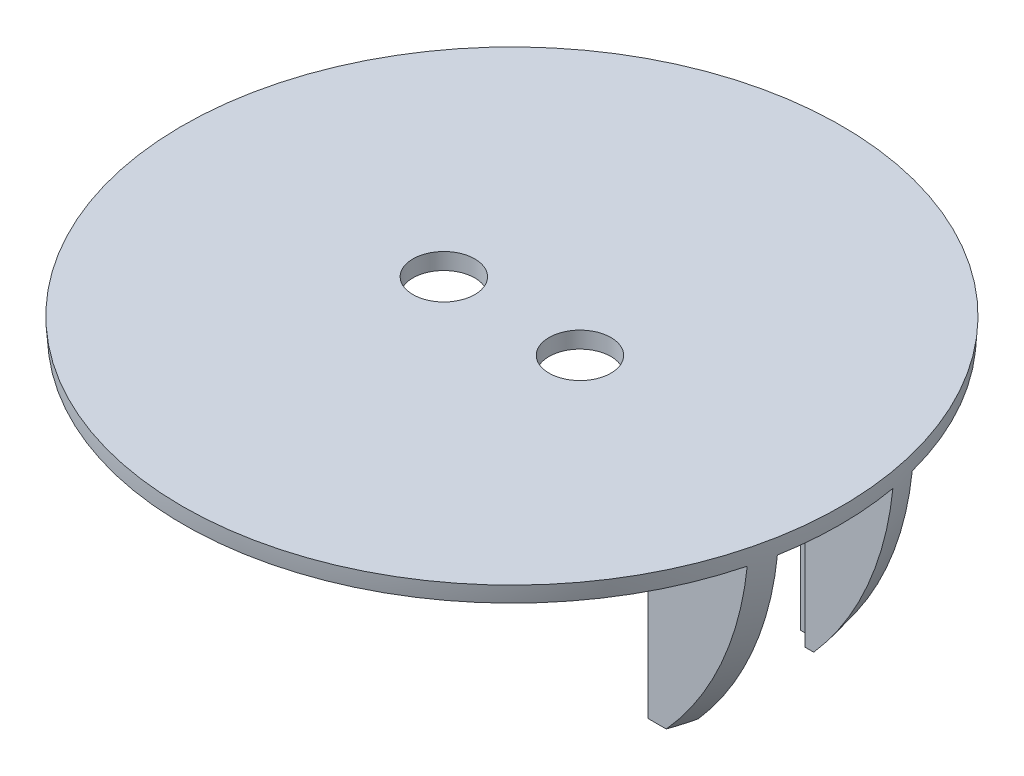
from build123d import *

# Parameters (mm, degrees)
SHELL2_T                 = -1
CUT_EXTRUDE2_DEPTH       = 96.571962416
BOSS_EXTRUDE1_REACH      = 96.52
BOSS_EXTRUDE1_END_RADIUS = 40
CUT_EXTRUDE3_DEPTH       = 97.075491151
CUT_EXTRUDE3_DEPTH_BACK  = 97.075491151
SKETCH17_R               = 3.75
CUT_EXTRUDE5_DEPTH       = 93.913386734


with BuildPart() as part:
    # Sketch1 → Revolve1 (revolve)
    with BuildSketch(Plane.XY):
        with BuildLine():
            Line((0, 0), (41, 0))
            Line((41, 0), (41, -27))
            Line((41, -27), (15.768453788, -27))
            Line((15.768453788, -27), (10.145502759, -27))
            ThreePointArc((10.145502759, -27), (2.620093884, -14.421609014), (0, 0))
        make_face()
    revolve(axis=Axis((41, 0, 0), (0, -1, 0)))

    # Shell2
    shell2_openings = [part.faces().sort_by_distance(p)[0] for p in [
        (41, 0, 0),
    ]]
    offset(amount=SHELL2_T, openings=shell2_openings, kind=Kind.INTERSECTION)

    # Sketch8 → Cut-Extrude2 (cut, through all)
    with BuildSketch(Plane.XY):
        with BuildLine():
            Line((37.25, -7.5), (37.25, -6.753553389))
            ThreePointArc((37.25, -6.753553389), (37.291866257, -6.543077502), (37.41109127, -6.364644661))
            Line((37.41109127, -6.364644661), (38.014644661, -5.76109127))
            ThreePointArc((38.014644661, -5.76109127), (38.193077503, -5.641866257), (38.403553391, -5.6))
            Line((38.403553391, -5.6), (43.596446609, -5.6))
            ThreePointArc((43.596446609, -5.6), (43.806922497, -5.641866257), (43.985355339, -5.76109127))
            Line((43.985355339, -5.76109127), (44.58890873, -6.364644661))
            ThreePointArc((44.58890873, -6.364644661), (44.708133743, -6.543077502), (44.75, -6.753553389))
            Line((44.75, -6.753553389), (44.75, -7.5))
            ThreePointArc((44.75, -7.5), (44.58890873, -7.88890873), (44.2, -8.05))
            Line((44.2, -8.05), (37.8, -8.05))
            ThreePointArc((37.8, -8.05), (37.41109127, -7.88890873), (37.25, -7.5))
        make_face()
    extrude(amount=CUT_EXTRUDE2_DEPTH, mode=Mode.SUBTRACT)


with BuildPart() as body_2:
    # Sketch13 → Revolve2 (revolve)
    with BuildSketch(Plane.XY):
        with BuildLine():
            Line((41, -2), (80.949968711, -2))
            ThreePointArc((80.949968711, -2), (80.887270395, -3.000943251), (80.799497484, -4))
            Line((80.799497484, -4), (41, -4))
            Line((41, -4), (41, -2))
        make_face()
    revolve(axis=Axis((41, -2, 0), (0, -1, 0)))


with BuildPart() as body_3:
    # Boss-Extrude1: up to this sphere (the profile starts inside it)
    boss_extrude1_end = Location((41, 0, 0)) * Sphere(BOSS_EXTRUDE1_END_RADIUS, mode=Mode.PRIVATE)
    # Sketch15 → Boss-Extrude1 (new, up to the surface)
    with BuildSketch(Plane.XZ.offset(4), mode=Mode.PRIVATE) as boss_extrude1_sk1:
        with BuildLine():
            Line((12.5, 8.5), (12.5, 7))
            Line((12.5, 7), (1.820923952, 7))
            ThreePointArc((1.820923952, 7), (2.120155615, 8.506332972), (2.477279431, 10))
            Line((2.477279431, 10), (14.5, 10))
            Line((14.5, 10), (14.5, 8.5))
            Line((14.5, 8.5), (12.5, 8.5))
        make_face()
    boss_extrude1_tool1 = extrude(boss_extrude1_sk1.sketch, amount=BOSS_EXTRUDE1_REACH, mode=Mode.PRIVATE) & boss_extrude1_end
    add(boss_extrude1_tool1.solids().sort_by_distance((7.856829, -4, 8.551531))[0])
    # Sketch15 → Boss-Extrude1 (new, up to the surface)
    with BuildSketch(Plane.XZ.offset(4), mode=Mode.PRIVATE) as boss_extrude1_sk2:
        with BuildLine():
            Line((14.5, -8.5), (12.5, -8.5))
            Line((12.5, -8.5), (12.5, -7))
            Line((12.5, -7), (1.820923952, -7))
            ThreePointArc((1.820923952, -7), (2.120155615, -8.506332972), (2.477279431, -10))
            Line((2.477279431, -10), (14.5, -10))
            Line((14.5, -10), (14.5, -8.5))
        make_face()
    boss_extrude1_tool2 = extrude(boss_extrude1_sk2.sketch, amount=BOSS_EXTRUDE1_REACH, mode=Mode.PRIVATE) & boss_extrude1_end
    add(boss_extrude1_tool2.solids().sort_by_distance((7.856829, -4, -8.551531))[0])
    # Sketch15 → Boss-Extrude1 (new, up to the surface)
    with BuildSketch(Plane.XZ.offset(4), mode=Mode.PRIVATE) as boss_extrude1_sk3:
        with BuildLine():
            Line((69.5, -8.5), (69.5, -7))
            Line((69.5, -7), (80.179076048, -7))
            ThreePointArc((80.179076048, -7), (79.879844385, -8.506332972), (79.522720569, -10))
            Line((79.522720569, -10), (67.5, -10))
            Line((67.5, -10), (67.5, -8.5))
            Line((67.5, -8.5), (69.5, -8.5))
        make_face()
    boss_extrude1_tool3 = extrude(boss_extrude1_sk3.sketch, amount=BOSS_EXTRUDE1_REACH, mode=Mode.PRIVATE) & boss_extrude1_end
    add(boss_extrude1_tool3.solids().sort_by_distance((74.143171, -4, -8.551531))[0])
    # Sketch15 → Boss-Extrude1 (new, up to the surface)
    with BuildSketch(Plane.XZ.offset(4), mode=Mode.PRIVATE) as boss_extrude1_sk4:
        with BuildLine():
            Line((67.5, 8.5), (69.5, 8.5))
            Line((69.5, 8.5), (69.5, 7))
            Line((69.5, 7), (80.179076048, 7))
            ThreePointArc((80.179076048, 7), (79.879844385, 8.506332972), (79.522720569, 10))
            Line((79.522720569, 10), (67.5, 10))
            Line((67.5, 10), (67.5, 8.5))
        make_face()
    boss_extrude1_tool4 = extrude(boss_extrude1_sk4.sketch, amount=BOSS_EXTRUDE1_REACH, mode=Mode.PRIVATE) & boss_extrude1_end
    add(boss_extrude1_tool4.solids().sort_by_distance((74.143171, -4, 8.551531))[0])


with BuildPart() as cut_extrude3_tool:
    # Sketch16 → Cut-Extrude3 (new, two sides: drawn at the far end of the back side and taken through both)
    with BuildSketch(Plane.XY.offset(-CUT_EXTRUDE3_DEPTH_BACK)):
        Polygon((69.5, -28.731515797), (10.145502759, -28.731515797), (10.145502759, -26), (73.929059096, -26), (73.929059096, -28.731515797), align=None)
    extrude(amount=CUT_EXTRUDE3_DEPTH + CUT_EXTRUDE3_DEPTH_BACK)


with BuildPart() as part_1:
    add(part.part)

    # Cut-Extrude3: cut by cut_extrude3_tool
    add(cut_extrude3_tool.part, mode=Mode.SUBTRACT)


with BuildPart() as body_3_1:
    add(body_3.part)

    # Cut-Extrude3: cut by cut_extrude3_tool
    add(cut_extrude3_tool.part, mode=Mode.SUBTRACT)


with BuildPart() as body_2_1:
    add(body_2.part)

    # Combine1: union body 3
    add(body_3_1.part)

    # Sketch17 → Cut-Extrude5 (cut, through all)
    with BuildSketch(Plane.XZ.offset(4)):
        with Locations((49.25, 0)):
            Circle(SKETCH17_R)
        with Locations((32.75, 0)):
            Circle(SKETCH17_R)
    extrude(amount=-CUT_EXTRUDE5_DEPTH, mode=Mode.SUBTRACT)


solid = body_2_1.part
